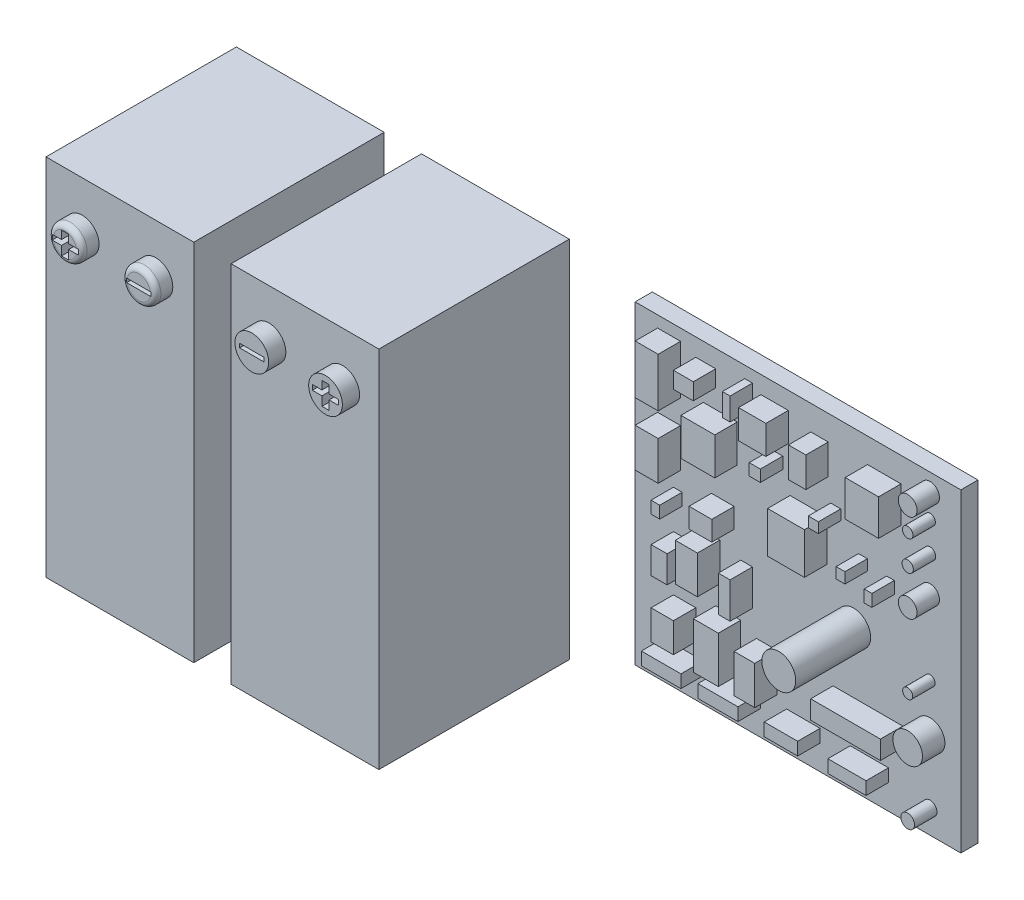
from build123d import *

# Parameters (mm, degrees)
SKETCH1_W             = 56.302869219
SKETCH1_H             = 138.766667569
BOSS_EXTRUDE1_DEPTH   = 72.54
BOSS_EXTRUDE1_2_DEPTH = 72.54
SKETCH2_R             = 6.429272106
SKETCH2_W             = 9.201212179
SKETCH2_H             = 1.516845506
BOSS_EXTRUDE2_DEPTH   = 6.54
FILLET2_R             = 2
SKETCH3_W             = 124.092777313
SKETCH3_H             = 119.832608542
BOSS_EXTRUDE3_DEPTH   = 6.54
SKETCH4_W             = 12.914846671
SKETCH4_H             = 14.208226805
SKETCH4_W_2           = 12.737327791
SKETCH4_H_2           = 13.715037719
SKETCH4_W_3           = 14.020613583
SKETCH4_H_3           = 15.746942929
SKETCH4_W_4           = 15.06815555
SKETCH4_H_4           = 4.879860311
SKETCH4_W_5           = 15.289306242
SKETCH4_W_6           = 12.74885419
SKETCH4_W_7           = 14.54979226
BOSS_EXTRUDE4_DEPTH   = 8.54
SKETCH5_R             = 3.578704442
SKETCH5_R_2           = 2.008994096
SKETCH5_R_3           = 2.14958232
SKETCH5_R_4           = 3.560835832
SKETCH5_R_5           = 1.918006963
SKETCH5_R_6           = 5.638388175
SKETCH5_R_7           = 2.612733035
SKETCH5_W             = 8.419975697
SKETCH5_H             = 14.45603503
SKETCH5_W_2           = 6.623748963
SKETCH5_H_2           = 11.45911706
SKETCH5_W_3           = 8.758234142
SKETCH5_H_3           = 18.689795566
SKETCH5_H_4           = 14.796617228
SKETCH5_W_4           = 10.409936465
SKETCH5_H_5           = 10.947041627
BOSS_EXTRUDE5_DEPTH   = 8.54
SKETCH6_R             = 2.888118935
SKETCH6_W             = 26.567713894
SKETCH6_H             = 7.094858079
BOSS_EXTRUDE6_DEPTH   = 8.54
SKETCH7_W             = 3.356936438
SKETCH7_H             = 4.103885869
SKETCH7_W_2           = 2.917434914
SKETCH7_H_2           = 4.629360024
SKETCH7_W_3           = 3.841888177
SKETCH7_H_3           = 3.904645268
SKETCH7_W_4           = 4.258664593
SKETCH7_H_4           = 4.448597363
SKETCH7_W_5           = 7.589013681
SKETCH7_H_5           = 6.29865999
SKETCH7_W_6           = 2.947884506
SKETCH7_H_6           = 8.594718526
SKETCH7_W_7           = 3.311486223
SKETCH7_H_7           = 4.599347668
SKETCH7_W_8           = 8.65367983
SKETCH7_H_8           = 7.533699189
SKETCH7_W_9           = 6.115743946
SKETCH7_H_9           = 10.262354378
SKETCH7_W_10          = 8.523260289
SKETCH7_H_10          = 11.247998564
SKETCH7_W_11          = 9.519923981
SKETCH7_H_11          = 17.640511647
SKETCH7_W_12          = 4.483225595
SKETCH7_H_12          = 13.667434753
SKETCH7_W_13          = 7.874922212
SKETCH7_H_13          = 14.62668188
BOSS_EXTRUDE7_DEPTH   = 8.54
SKETCH8_R             = 6.460515748
BOSS_EXTRUDE8_DEPTH   = 28.54


with BuildPart() as part:
    # Sketch1 → Boss-Extrude1 (new body)
    with BuildSketch(Plane.XY):
        with Locations((-280.710257594, 69.383333785)):
            Rectangle(SKETCH1_W, SKETCH1_H)
    extrude(amount=BOSS_EXTRUDE1_DEPTH)



with BuildPart() as body_2:
    # Sketch1 → Boss-Extrude1 2 (new body)
    with BuildSketch(Plane.XY):
        with Locations((-210.189492108, 69.383333785)):
            Rectangle(SKETCH1_W, SKETCH1_H)
    extrude(amount=BOSS_EXTRUDE1_2_DEPTH)


with BuildPart() as part_1:
    add(part.part)

    add(body_2.part)  # Boss-Extrude2 merges body 2
    # Sketch2 → Boss-Extrude2 (add)
    # profile 1 of 4: a face of its own
    with BuildSketch(Plane.XY.offset(72.54)):
        with Locations((-295.07478672, 120)):
            Circle(SKETCH2_R)
        Polygon((-296.420414336, 124.103728711), (-293.71586423, 124.103728711), (-293.71586423, 120.967861221), (-290.055220897, 120.967861221), (-290.055220897, 119.032138779), (-293.71586423, 119.032138779), (-293.71586423, 115.561030955), (-296.420414336, 115.561030955), (-296.420414336, 119.032138779), (-299.967152144, 119.032138779), (-299.967152144, 120.967861221), (-296.420414336, 120.967861221), align=None, mode=Mode.SUBTRACT)
    # profile 2 of 4: a face of its own
    with BuildSketch(Plane.XY.offset(72.54)):
        with Locations((-266.984470047, 120)):
            Circle(SKETCH2_R)
        with Locations((-266.984470047, 119.936640266)):
            Rectangle(SKETCH2_W, SKETCH2_H, mode=Mode.SUBTRACT)
    # profile 3 of 4: a face of its own
    with BuildSketch(Plane.XY.offset(72.54)):
        with Locations(Location((-223.915279655, 120, 0), (0, 0, 180))):
            Circle(SKETCH2_R)
        with Locations((-223.915279655, 119.936640266)):
            Rectangle(SKETCH2_W, SKETCH2_H, mode=Mode.SUBTRACT)
    # profile 4 of 4: a face of its own
    with BuildSketch(Plane.XY.offset(72.54)):
        with Locations(Location((-195.824962981, 120, 0), (0, 0, 180))):
            Circle(SKETCH2_R)
        Polygon((-197.183885471, 119.032138779), (-197.183885471, 115.561030955), (-194.479335365, 115.561030955), (-194.479335365, 119.032138779), (-190.932597557, 119.032138779), (-190.932597557, 120.967861221), (-194.479335365, 120.967861221), (-194.479335365, 124.103728711), (-197.183885471, 124.103728711), (-197.183885471, 120.967861221), (-200.844528804, 120.967861221), (-200.844528804, 119.032138779), align=None, mode=Mode.SUBTRACT)
    extrude(amount=BOSS_EXTRUDE2_DEPTH)

    # Fillet2
    # the kernel refuses this fillet: 2 mm, written as the material it takes off along each edge
    with BuildSketch(Plane(origin=(-295.07478672, 120, 79.08), x_dir=(1, 0, 0), z_dir=(0, -1, 0))) as fillet2_piece_1:
        with BuildLine():
            CenterArc((6.429272106 - FILLET2_R, -FILLET2_R), FILLET2_R, 0, 90)
            Line((6.429272106 - FILLET2_R, 0), (6.429272106, 0))
            Line((6.429272106, 0), (6.429272106, -FILLET2_R))
        make_face()
    revolve(axis=Axis((-295.07478672, 120, 79.08), (0, 0, 1)), mode=Mode.SUBTRACT)
    with BuildSketch(Plane(origin=(-266.984470047, 120, 79.08), x_dir=(1, 0, 0), z_dir=(0, -1, 0))) as fillet2_piece_2:
        with BuildLine():
            CenterArc((6.429272106 - FILLET2_R, -FILLET2_R), FILLET2_R, 0, 90)
            Line((6.429272106 - FILLET2_R, 0), (6.429272106, 0))
            Line((6.429272106, 0), (6.429272106, -FILLET2_R))
        make_face()
    revolve(axis=Axis((-266.984470047, 120, 79.08), (0, 0, 1)), mode=Mode.SUBTRACT)


with BuildPart() as body_2_2:
    # Sketch3 → Boss-Extrude3 (new body)
    with BuildSketch(Plane.XY):
        with Locations((-88.356419727, 77.249244185)):
            Rectangle(SKETCH3_W, SKETCH3_H)
    extrude(amount=BOSS_EXTRUDE3_DEPTH)

    # Sketch4 → Boss-Extrude4 (add)
    with BuildSketch(Plane.XY.offset(6.54)):
        with Locations((-117.966729306, 109.869531362)):
            Rectangle(SKETCH4_W, SKETCH4_H)
        with Locations((-55.484069099, 120.88380777)):
            Rectangle(SKETCH4_W_2, SKETCH4_H_2)
        with Locations((-84.374296282, 94.891946495)):
            Rectangle(SKETCH4_W_3, SKETCH4_H_3)
        with Locations((-131.958230416, 29.235331767)):
            Rectangle(SKETCH4_W_4, SKETCH4_H_4)
        with Locations((-110.322076184, 29.235331767)):
            Rectangle(SKETCH4_W_5, SKETCH4_H_4)
        with Locations((-86.314499596, 29.235331767)):
            Rectangle(SKETCH4_W_6, SKETCH4_H_4)
        with Locations((-61.154894884, 29.235331767)):
            Rectangle(SKETCH4_W_7, SKETCH4_H_4)
    extrude(amount=BOSS_EXTRUDE4_DEPTH)

    # Sketch5 → Boss-Extrude5 (add)
    with BuildSketch(Plane.XY.offset(6.54)):
        with Locations((-38.024083664, 130.510567699)):
            Circle(SKETCH5_R)
        with Locations((-38.024083664, 121.572520168)):
            Circle(SKETCH5_R_2)
        with Locations((-38.024083664, 110.347896176)):
            Circle(SKETCH5_R_3)
        with Locations((-38.024083664, 96.807518612)):
            Circle(SKETCH5_R_4)
        with Locations((-38.024083664, 68.424516813)):
            Circle(SKETCH5_R_5)
        with Locations((-38.024083664, 50.497769135)):
            Circle(SKETCH5_R_6)
        with Locations((-38.024083664, 26.326726503)):
            Circle(SKETCH5_R_7)
        with Locations((-122.365299413, 67.446279166)):
            Rectangle(SKETCH5_W, SKETCH5_H)
        with Locations((-80.147762257, 121.971550379)):
            Rectangle(SKETCH5_W_2, SKETCH5_H_2)
        with Locations((-137.477127946, 123.441765345)):
            Rectangle(SKETCH5_W_3, SKETCH5_H_3)
        with Locations((-137.477127946, 97.591071945)):
            Rectangle(SKETCH5_W_3, SKETCH5_H_4)
        with Locations((-97.257868221, 125.037046886)):
            Rectangle(SKETCH5_W_4, SKETCH5_H_5)
    extrude(amount=BOSS_EXTRUDE5_DEPTH)

    # Sketch6 → Boss-Extrude6 (add)
    with BuildSketch(Plane.XY.offset(6.54)):
        with Locations((-86.341857789, 53.322335752)):
            Circle(SKETCH6_R)
        with Locations((-61.700061006, 44.615688523)):
            Rectangle(SKETCH6_W, SKETCH6_H)
    extrude(amount=BOSS_EXTRUDE6_DEPTH)

    # Sketch7 → Boss-Extrude7 (add)
    with BuildSketch(Plane.XY.offset(6.54)):
        with Locations((-63.599738705, 94.601693791)):
            Rectangle(SKETCH7_W, SKETCH7_H)
        with Locations((-53.116239389, 92.287013779)):
            Rectangle(SKETCH7_W_2, SKETCH7_H_2)
        with Locations((-73.98119921, 106.0705384)):
            Rectangle(SKETCH7_W_3, SKETCH7_H_3)
        with Locations((-96.289427522, 112.162526468)):
            Rectangle(SKETCH7_W_4, SKETCH7_H_4)
        with Locations((-123.487278413, 127.271371254)):
            Rectangle(SKETCH7_W_5, SKETCH7_H_5)
        with Locations((-107.163564249, 128.419400522)):
            Rectangle(SKETCH7_W_6, SKETCH7_H_6)
        with Locations((-134.149302431, 80.993107434)):
            Rectangle(SKETCH7_W_7, SKETCH7_H_7)
        with Locations((-116.997828798, 84.759957028)):
            Rectangle(SKETCH7_W_8, SKETCH7_H_8)
        with Locations((-132.747173569, 63.521235873)):
            Rectangle(SKETCH7_W_9, SKETCH7_H_9)
        with Locations((-131.543415398, 42.151562207)):
            Rectangle(SKETCH7_W_10, SKETCH7_H_10)
        with Locations((-114.932809582, 43.402927437)):
            Rectangle(SKETCH7_W_11, SKETCH7_H_11)
        with Locations((-107.931234794, 65.223776061)):
            Rectangle(SKETCH7_W_12, SKETCH7_H_12)
        with Locations((-100.226888627, 41.896012553)):
            Rectangle(SKETCH7_W_13, SKETCH7_H_13)
    extrude(amount=BOSS_EXTRUDE7_DEPTH)

    # Sketch8 → Boss-Extrude8 (add)
    with BuildSketch(Plane.XY.offset(6.54)):
        with Locations((-67.128134839, 71.280818151)):
            Circle(SKETCH8_R)
    extrude(amount=BOSS_EXTRUDE8_DEPTH)


solid = Compound([part_1.part, body_2_2.part])
